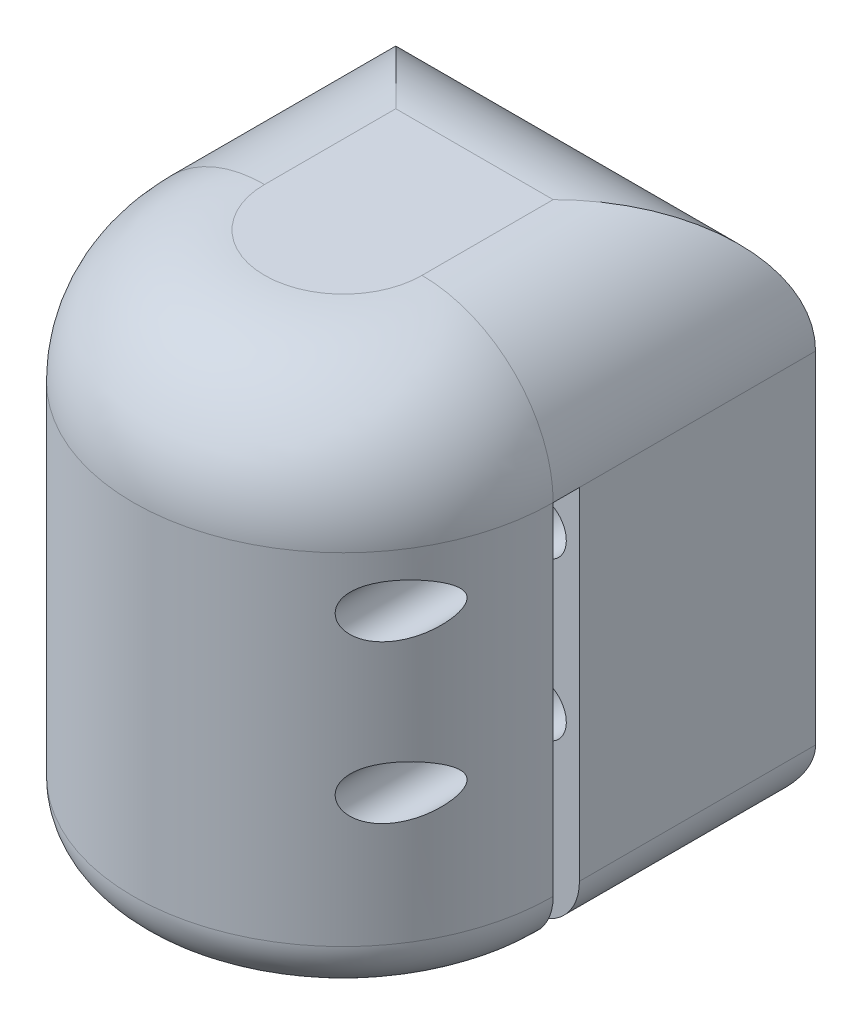
from build123d import *

# Parameters (mm, degrees)
BOSS_EXTRU_1_DEPTH           = 15
ESQUISSE3_R                  = 5
BOSS_EXTRU_3_DEPTH           = 5
ENL_V_MAT_EXTRU_2_REACH      = 30.071
ESQUISSE4_R                  = 1
ENL_V_MAT_EXTRU_3_REACH      = 29.495
ENL_V_MAT_EXTRU_3_END_RADIUS = 5
ESQUISSE5_W                  = 1
ESQUISSE5_H                  = 15
CONG_3_START                 = -10
CONG_3_DEPTH                 = 18
CONG_3_START_2               = -9
CONG_3_2_DEPTH               = 18
CONG_3_3_ANGLE               = 180
CONG_5_R                     = 2


with BuildPart() as part:
    # Esquisse1 → Boss.-Extru.1 (new body)
    with BuildSketch(Plane(origin=(0, 0, 0), x_dir=(1, 0, 0), z_dir=(0, 1, 0))):
        with BuildLine():
            ThreePointArc((-8, 0), (0, 8), (8, 0))
            Line((8, 0), (8, 10))
            Line((8, 10), (-8, 10))
            Line((-8, 10), (-8, 0))
        make_face()
        with BuildLine():
            ThreePointArc((-8, 0), (0, -8), (8, 0))
            Line((8, 0), (4.902542424, 0))
            ThreePointArc((4.902542424, 0), (-0.097457576, -5), (-5.097457576, 0))
            Line((-5.097457576, 0), (-8, 0))
        make_face()
        with BuildLine():
            Line((4.902542424, 0), (8, 0))
            ThreePointArc((8, 0), (0, 8), (-8, 0))
            Line((-8, 0), (-5.097457576, 0))
            ThreePointArc((-5.097457576, 0), (-0.097457576, 5), (4.902542424, 0))
        make_face()
    extrude(amount=BOSS_EXTRU_1_DEPTH)

    # Esquisse3 → Boss.-Extru.3 (add)
    # profile 1 of 3: a face of its own
    with BuildSketch(Plane(origin=(0, 15, 0), x_dir=(1, 0, 0), z_dir=(0, 1, 0))):
        with BuildLine():
            ThreePointArc((8, 0), (0, 8), (-8, 0))
            ThreePointArc((-8, 0), (0, -8), (8, 0))
        make_face()
        with Locations(Location((-0.097457576, 0, 0), (0, 0, 270))):
            Circle(ESQUISSE3_R, mode=Mode.SUBTRACT)
    # profile 2 of 3: a face of its own
    with BuildSketch(Plane(origin=(0, 15, 0), x_dir=(1, 0, 0), z_dir=(0, 1, 0))):
        with Locations(Location((-0.097457576, 0, 0), (0, 0, 270))):
            Circle(ESQUISSE3_R)
    # profile 3 of 3: a face of its own
    with BuildSketch(Plane(origin=(0, 15, 0), x_dir=(1, 0, 0), z_dir=(0, 1, 0))):
        with BuildLine():
            Line((-8, 10), (-8, 0))
            ThreePointArc((-8, 0), (0, 8), (8, 0))
            Line((8, 0), (8, 10))
            Line((8, 10), (-8, 10))
        make_face()
    extrude(amount=BOSS_EXTRU_3_DEPTH)

    # Esquisse4 → Enlèv. mat.-Extru.2 (cut, up to next)
    with BuildSketch(Plane(origin=(0, 0, -10), x_dir=(-1, 0, 0), z_dir=(0, 0, -1)), mode=Mode.PRIVATE) as enl_v_mat_extru_2_sk1:
        with Locations((-6.5, 13)):
            Circle(ESQUISSE4_R)
    enl_v_mat_extru_2_tool1 = extrude(enl_v_mat_extru_2_sk1.sketch, amount=-ENL_V_MAT_EXTRU_2_REACH, mode=Mode.PRIVATE) & part.part
    # Esquisse4 → Enlèv. mat.-Extru.2 (cut, up to next)
    with BuildSketch(Plane(origin=(0, 0, -10), x_dir=(-1, 0, 0), z_dir=(0, 0, -1)), mode=Mode.PRIVATE) as enl_v_mat_extru_2_sk2:
        with Locations((6.5, 13)):
            Circle(ESQUISSE4_R)
    enl_v_mat_extru_2_tool2 = extrude(enl_v_mat_extru_2_sk2.sketch, amount=-ENL_V_MAT_EXTRU_2_REACH, mode=Mode.PRIVATE) & part.part
    # Esquisse4 → Enlèv. mat.-Extru.2 (cut, up to next)
    with BuildSketch(Plane(origin=(0, 0, -10), x_dir=(-1, 0, 0), z_dir=(0, 0, -1)), mode=Mode.PRIVATE) as enl_v_mat_extru_2_sk3:
        with Locations((6.5, 7)):
            Circle(ESQUISSE4_R)
    enl_v_mat_extru_2_tool3 = extrude(enl_v_mat_extru_2_sk3.sketch, amount=-ENL_V_MAT_EXTRU_2_REACH, mode=Mode.PRIVATE) & part.part
    # Esquisse4 → Enlèv. mat.-Extru.2 (cut, up to next)
    with BuildSketch(Plane(origin=(0, 0, -10), x_dir=(-1, 0, 0), z_dir=(0, 0, -1)), mode=Mode.PRIVATE) as enl_v_mat_extru_2_sk4:
        with Locations((-6.5, 7)):
            Circle(ESQUISSE4_R)
    enl_v_mat_extru_2_tool4 = extrude(enl_v_mat_extru_2_sk4.sketch, amount=-ENL_V_MAT_EXTRU_2_REACH, mode=Mode.PRIVATE) & part.part
    add(enl_v_mat_extru_2_tool1.solids().sort_by_distance((6.5, 13, -10))[0], mode=Mode.SUBTRACT)
    add(enl_v_mat_extru_2_tool2.solids().sort_by_distance((-6.5, 13, -10))[0], mode=Mode.SUBTRACT)
    add(enl_v_mat_extru_2_tool3.solids().sort_by_distance((-6.5, 7, -10))[0], mode=Mode.SUBTRACT)
    add(enl_v_mat_extru_2_tool4.solids().sort_by_distance((6.5, 7, -10))[0], mode=Mode.SUBTRACT)

    # Enlèv. mat.-Extru.3: up to this cylinder (the profile starts outside it)
    enl_v_mat_extru_3_end = Plane(origin=(-0.097457576, 7.5, 0), z_dir=(0, -1, 0)) * Cylinder(ENL_V_MAT_EXTRU_3_END_RADIUS, 69.99, mode=Mode.PRIVATE)
    # Esquisse5 → Enlèv. mat.-Extru.3 (cut, up to the surface)
    with BuildSketch(Plane(origin=(8, 0, 0), x_dir=(0, 0, -1), z_dir=(1, 0, 0)), mode=Mode.PRIVATE) as enl_v_mat_extru_3_sk1:
        with Locations((0.5, 7.5)):
            Rectangle(ESQUISSE5_W, ESQUISSE5_H)
    enl_v_mat_extru_3_tool1 = extrude(enl_v_mat_extru_3_sk1.sketch, amount=-ENL_V_MAT_EXTRU_3_REACH, mode=Mode.PRIVATE) - enl_v_mat_extru_3_end
    add(enl_v_mat_extru_3_tool1.solids().sort_by_distance((8, 7.5, -0.5))[0], mode=Mode.SUBTRACT)

    # Congé3: read off the stored shape, not the designer's step
    # Congé3 outline → Congé3 (cut)
    with BuildSketch(Plane.XY.offset(CONG_3_START)):
        with BuildLine():
            ThreePointArc((-8, 15), (-6.535533906, 18.535533906), (-3, 20))
            Line((-3, 20), (-8, 20))
            Line((-8, 20), (-8, 15))
        make_face()
        with BuildLine():
            ThreePointArc((3, 20), (6.535533906, 18.535533906), (8, 15))
            Line((8, 15), (8, 20))
            Line((8, 20), (3, 20))
        make_face()
    extrude(amount=CONG_3_DEPTH, mode=Mode.SUBTRACT)

    # Cong_3 2 outline → Cong_3 2 (cut)
    with BuildSketch(Plane.YZ.offset(CONG_3_START_2)):
        with BuildLine():
            ThreePointArc((20, -5), (18.535533906, -8.535533906), (15, -10))
            Line((15, -10), (20, -10))
            Line((20, -10), (20, -5))
        make_face()
    extrude(amount=CONG_3_2_DEPTH, mode=Mode.SUBTRACT)

    # Cong_3 3 outline → Cong_3 3 (revolve, cut)
    with BuildSketch(Plane(origin=(0, 0, 0), x_dir=(-1, 0, 0), z_dir=(0, 0, -1))):
        with BuildLine():
            ThreePointArc((3, 20), (6.535533906, 18.535533906), (8, 15))
            Line((8, 15), (8, 20))
            Line((8, 20), (3, 20))
        make_face()
    revolve(axis=Axis((0, 0, 0), (0, 1, 0)), revolution_arc=CONG_3_3_ANGLE, mode=Mode.SUBTRACT)

    # Congé5
    cong_5_edges = [part.edges().sort_by_distance(p)[0] for p in [
        (8, 0, -5.5),
        (0, 0, -10),
        (0, 0, 8),
        (-8, 0, -5),
    ]]
    fillet(cong_5_edges, radius=CONG_5_R)


solid = part.part
